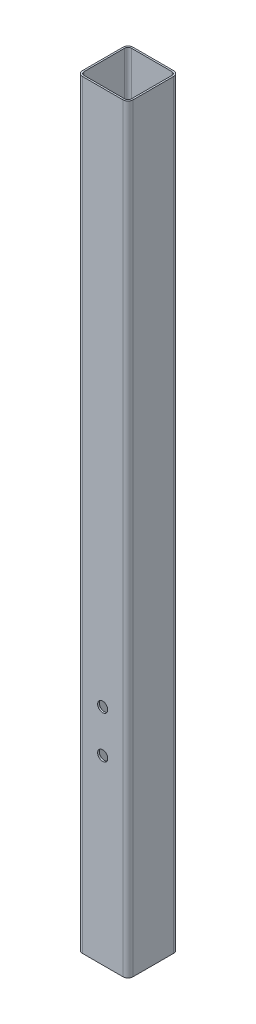
from build123d import *

# Parameters (mm, degrees)
BOSS_EXTRUDE1_DEPTH = 450
SHELL1_T            = -2
SKETCH4_R           = 6
CUT_EXTRUDE3_DEPTH  = 455.972526643


with BuildPart() as part:
    # Sketch1 → Boss-Extrude1 (new, symmetric)
    with BuildSketch(Plane(origin=(0, 0, 0), x_dir=(1, 0, 0), z_dir=(0, 1, 0))):
        with BuildLine():
            Line((-24, -30), (24, -30))
            ThreePointArc((24, -30), (28.242640687, -28.242640687), (30, -24))
            Line((30, -24), (30, 24))
            ThreePointArc((30, 24), (28.242640687, 28.242640687), (24, 30))
            Line((24, 30), (-24, 30))
            ThreePointArc((-24, 30), (-28.242640687, 28.242640687), (-30, 24))
            Line((-30, 24), (-30, -24))
            ThreePointArc((-30, -24), (-28.242640687, -28.242640687), (-24, -30))
        make_face()
    extrude(amount=BOSS_EXTRUDE1_DEPTH, both=True)

    # Shell1
    shell1_openings = [part.faces().sort_by_distance(p)[0] for p in [
        (0, -450, 0),
        (0, 450, 0),
    ]]
    offset(amount=SHELL1_T, openings=shell1_openings, kind=Kind.INTERSECTION)

    # Sketch4 → Cut-Extrude3 (cut, through all)
    with BuildSketch(Plane(origin=(0, 0, -30), x_dir=(-1, 0, 0), z_dir=(0, 0, -1))):
        with Locations((0, -235)):
            Circle(SKETCH4_R)
        with Locations((0, -185)):
            Circle(SKETCH4_R)
    extrude(amount=-CUT_EXTRUDE3_DEPTH, mode=Mode.SUBTRACT)


solid = part.part
